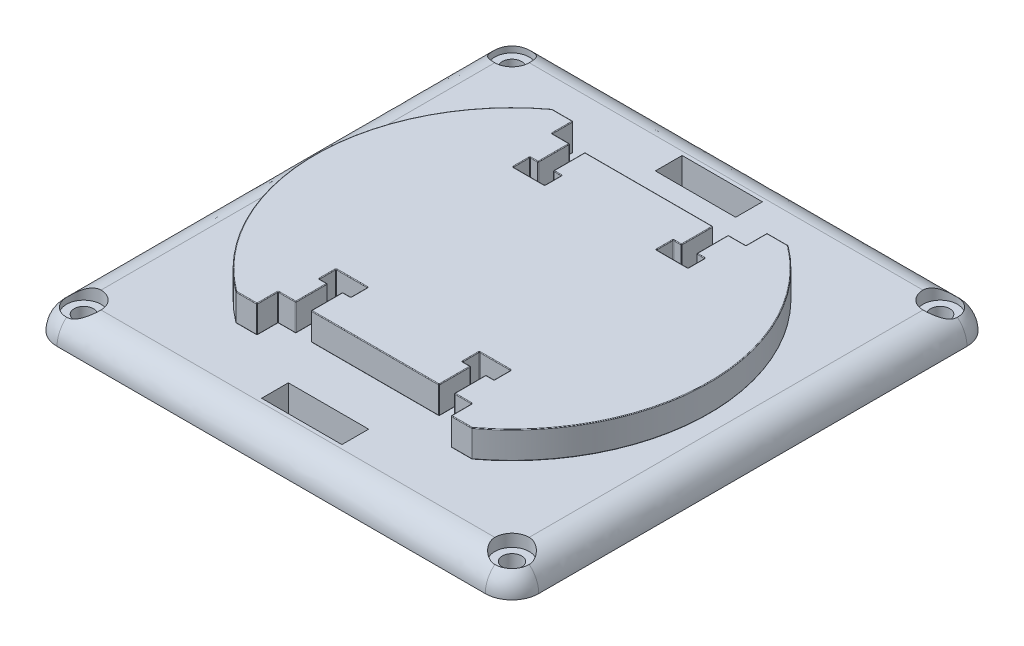
from build123d import *

# Parameters (mm, degrees)
BOSS_EXTRUDE1_DEPTH = 6.5
SKETCH2_W           = 3.6
SKETCH2_H           = 7.5
SKETCH2_W_2         = 7.5
SKETCH2_H_2         = 4
CUT_EXTRUDE1_DEPTH  = 61.322052352
FILLET1_R           = 0.15
SKETCH3_W           = 114.3
SKETCH3_H           = 114.3
BOSS_EXTRUDE2_DEPTH = 6.35
FILLET4_R           = 6.35
FILLET5_R           = 6.35
FILLET6_R           = 6.35
FILLET7_R           = 6.35
SKETCH4_R           = 4.0894
CUT_EXTRUDE3_DEPTH  = 2.921
SKETCH5_R           = 2.286
CUT_EXTRUDE4_DEPTH  = 82.083259827
SKETCH6_W           = 19.05
SKETCH6_H           = 6.35
CUT_EXTRUDE5_DEPTH  = 82.083259827


with BuildPart() as part:
    # Sketch1 → Boss-Extrude1 (new body)
    with BuildSketch(Plane(origin=(0, 0, 0), x_dir=(1, 0, 0), z_dir=(0, 1, 0))):
        with BuildLine():
            Line((-28, 37.5), (-23, 37.5))
            Line((-23, 37.5), (-23, 32.5))
            Line((-23, 32.5), (23, 32.5))
            Line((23, 32.5), (23, 37.5))
            Line((23, 37.5), (28, 37.5))
            ThreePointArc((28, 37.5), (46.800106837, 0), (28, -37.5))
            Line((28, -37.5), (23, -37.5))
            Line((23, -37.5), (23, -32.5))
            Line((23, -32.5), (-23, -32.5))
            Line((-23, -32.5), (-23, -37.5))
            Line((-23, -37.5), (-28, -37.5))
            ThreePointArc((-28, -37.5), (-46.800106837, 0), (-28, 37.5))
        make_face()
    extrude(amount=BOSS_EXTRUDE1_DEPTH)

    # Sketch2 → Cut-Extrude1 (cut, through all)
    with BuildSketch(Plane(origin=(0, 6.5, 0), x_dir=(1, 0, 0), z_dir=(0, 1, 0))):
        with Locations((-17, 28.75)):
            Rectangle(SKETCH2_W, SKETCH2_H)
        with Locations((-17, 23)):
            Rectangle(SKETCH2_W_2, SKETCH2_H_2)
        with Locations((17, 23)):
            Rectangle(SKETCH2_W_2, SKETCH2_H_2)
        with Locations((17, 28.75)):
            Rectangle(SKETCH2_W, SKETCH2_H)
        with Locations((17, -28.75)):
            Rectangle(SKETCH2_W, SKETCH2_H)
        with Locations((17, -23)):
            Rectangle(SKETCH2_W_2, SKETCH2_H_2)
        with Locations((-17, -23)):
            Rectangle(SKETCH2_W_2, SKETCH2_H_2)
        with Locations((-17, -28.75)):
            Rectangle(SKETCH2_W, SKETCH2_H)
    extrude(amount=-CUT_EXTRUDE1_DEPTH, mode=Mode.SUBTRACT)

    # Fillet1
    fillet1_edges = [part.edges().sort_by_distance(p)[0] for p in [
        (15.2, 6.5, -28.75),
        (15.2, 3.25, -25),
        (15.2, 3.25, -32.5),
        (18.8, 0, -28.75),
        (18.8, 3.25, -32.5),
        (19.775, 0, -25),
        (13.25, 0, -23),
        (14.225, 0, -25),
        (15.2, 0, -28.75),
        (17, 6.5, -21),
        (20.75, 6.5, -23),
        (18.8, 6.5, -28.75),
        (17, 0, -21),
        (20.75, 3.25, -21),
        (13.25, 6.5, -23),
        (13.25, 3.25, -21),
        (20.75, 0, -23),
        (20.75, 3.25, -25),
        (18.8, 3.25, -25),
        (19.775, 6.5, -25),
        (13.25, 3.25, -25),
        (14.225, 6.5, -25),
        (-20.9, 0, 32.5),
        (-23, 0, 35),
        (46.800106837, 6.5, 0),
        (-25.5, 0, 37.5),
        (-46.800106837, 0, 0),
        (-25.5, 0, -37.5),
        (-23, 0, -35),
        (20.9, 0, -32.5),
        (23, 0, -35),
        (25.5, 0, -37.5),
        (46.800106837, 0, 0),
        (25.5, 0, 37.5),
        (23, 0, 35),
        (25.5, 6.5, -37.5),
        (23, 3.25, 32.5),
        (-23, 3.25, 32.5),
        (-23, 3.25, 37.5),
        (23, 6.5, -35),
        (-28, 3.25, 37.5),
        (-28, 3.25, -37.5),
        (-23, 3.25, -37.5),
        (-23, 3.25, -32.5),
        (23, 3.25, -32.5),
        (23, 3.25, -37.5),
        (28, 3.25, -37.5),
        (28, 3.25, 37.5),
        (23, 3.25, 37.5),
        (20.9, 6.5, -32.5),
        (-23, 6.5, -35),
        (-25.5, 6.5, -37.5),
        (0, 0, 32.5),
        (20.9, 0, 32.5),
        (-46.800106837, 6.5, 0),
        (0, 0, -32.5),
        (-20.9, 0, -32.5),
        (-25.5, 6.5, 37.5),
        (-23, 6.5, 35),
        (-20.9, 6.5, 32.5),
        (23, 6.5, 35),
        (0, 6.5, -32.5),
        (-20.9, 6.5, -32.5),
        (0, 6.5, 32.5),
        (20.9, 6.5, 32.5),
        (-18.8, 6.5, -28.75),
        (-18.8, 3.25, -25),
        (-18.8, 3.25, -32.5),
        (-15.2, 0, -28.75),
        (-15.2, 3.25, -32.5),
        (-17, 0, -21),
        (-20.75, 0, -23),
        (-18.8, 0, -28.75),
        (-19.775, 6.5, -25),
        (-13.25, 6.5, -23),
        (-14.225, 6.5, -25),
        (-15.2, 6.5, -28.75),
        (-17, 6.5, -21),
        (-13.25, 3.25, -21),
        (-20.75, 6.5, -23),
        (-20.75, 3.25, -21),
        (-13.25, 0, -23),
        (-13.25, 3.25, -25),
        (-14.225, 0, -25),
        (-15.2, 3.25, -25),
        (-19.775, 0, -25),
        (-20.75, 3.25, -25),
        (17, 6.5, 21),
        (13.25, 3.25, 21),
        (20.75, 6.5, 23),
        (20.75, 3.25, 21),
        (13.25, 0, 23),
        (13.25, 3.25, 25),
        (13.25, 6.5, 23),
        (14.225, 6.5, 25),
        (15.2, 6.5, 28.75),
        (19.775, 6.5, 25),
        (17, 0, 21),
        (20.75, 0, 23),
        (18.8, 0, 28.75),
        (14.225, 0, 25),
        (15.2, 3.25, 25),
        (19.775, 0, 25),
        (20.75, 3.25, 25),
        (18.8, 3.25, 32.5),
        (15.2, 0, 28.75),
        (15.2, 3.25, 32.5),
        (18.8, 6.5, 28.75),
        (18.8, 3.25, 25),
        (25.5, 6.5, 37.5),
        (-15.2, 6.5, 28.75),
        (-15.2, 3.25, 25),
        (-15.2, 3.25, 32.5),
        (-18.8, 0, 28.75),
        (-18.8, 3.25, 32.5),
        (-19.775, 0, 25),
        (-13.25, 0, 23),
        (-14.225, 0, 25),
        (-15.2, 0, 28.75),
        (-17, 6.5, 21),
        (-20.75, 6.5, 23),
        (-18.8, 6.5, 28.75),
        (-17, 0, 21),
        (-20.75, 3.25, 21),
        (-13.25, 6.5, 23),
        (-13.25, 3.25, 21),
        (-20.75, 0, 23),
        (-20.75, 3.25, 25),
        (-18.8, 3.25, 25),
        (-19.775, 6.5, 25),
        (-13.25, 3.25, 25),
        (-14.225, 6.5, 25),
    ]]
    fillet(fillet1_edges, radius=FILLET1_R)

    # Sketch3 → Boss-Extrude2 (add)
    with BuildSketch(Plane.XZ):
        Rectangle(SKETCH3_W, SKETCH3_H)
    extrude(amount=BOSS_EXTRUDE2_DEPTH)

    # Fillet4
    fillet4_edges = [part.edges().sort_by_distance(p)[0] for p in [
        (57.15, 0, 0),
    ]]
    fillet(fillet4_edges, radius=FILLET4_R - 0.0001)  # a hair under: the kernel refuses the full size

    # Fillet5
    fillet5_edges = [part.edges().sort_by_distance(p)[0] for p in [
        (55.29015735, -1.85984265, -57.15),
        (-3.17495, 0, -57.15),
    ]]
    fillet(fillet5_edges, radius=FILLET5_R - 0.0001)  # a hair under: the kernel refuses the full size

    # Fillet6
    fillet6_edges = [part.edges().sort_by_distance(p)[0] for p in [
        (-57.15, -1.85984265, -55.29015735),
        (-57.15, 0, 3.17495),
    ]]
    fillet(fillet6_edges, radius=FILLET6_R - 0.0001)  # a hair under: the kernel refuses the full size

    # Fillet7
    fillet7_edges = [part.edges().sort_by_distance(p)[0] for p in [
        (-55.29015735, -1.85984265, 57.15),
        (55.29015735, -1.85984265, 57.15),
        (0, 0, 57.15),
    ]]
    fillet(fillet7_edges, radius=FILLET7_R - 0.0001)  # a hair under: the kernel refuses the full size

    # Sketch4 → Cut-Extrude3 (cut)
    with BuildSketch(Plane(origin=(0, 0, 0), x_dir=(-1, 0, 0), z_dir=(0, -1, 0))):
        with Locations(Location((-50.8, 50.8, 0), (0, 0, 90))):
            Circle(SKETCH4_R)
        with Locations(Location((50.8, 50.8, 0), (0, 0, 270))):
            Circle(SKETCH4_R)
        with Locations(Location((-50.8, -50.8, 0), (0, 0, 270))):
            Circle(SKETCH4_R)
        with Locations(Location((50.8, -50.8, 0), (0, 0, 90))):
            Circle(SKETCH4_R)
    extrude(amount=CUT_EXTRUDE3_DEPTH, mode=Mode.SUBTRACT)

    # Sketch5 → Cut-Extrude4 (cut, through all)
    with BuildSketch(Plane(origin=(0, 0, 0), x_dir=(1, 0, 0), z_dir=(0, 1, 0))):
        with Locations(Location((50.8, 50.8, 0), (0, 0, 90))):
            Circle(SKETCH5_R)
        with Locations(Location((-50.8, 50.8, 0), (0, 0, 270))):
            Circle(SKETCH5_R)
        with Locations(Location((50.8, -50.8, 0), (0, 0, 270))):
            Circle(SKETCH5_R)
        with Locations(Location((-50.8, -50.8, 0), (0, 0, 90))):
            Circle(SKETCH5_R)
    extrude(amount=-CUT_EXTRUDE4_DEPTH, mode=Mode.SUBTRACT)

    # Sketch6 → Cut-Extrude5 (cut, through all)
    with BuildSketch(Plane(origin=(0, 0, 0), x_dir=(1, 0, 0), z_dir=(0, 1, 0))):
        with Locations((0, 46.7106)):
            Rectangle(SKETCH6_W, SKETCH6_H)
        with Locations((0, -46.7106)):
            Rectangle(SKETCH6_W, SKETCH6_H)
    extrude(amount=-CUT_EXTRUDE5_DEPTH, mode=Mode.SUBTRACT)


solid = part.part
